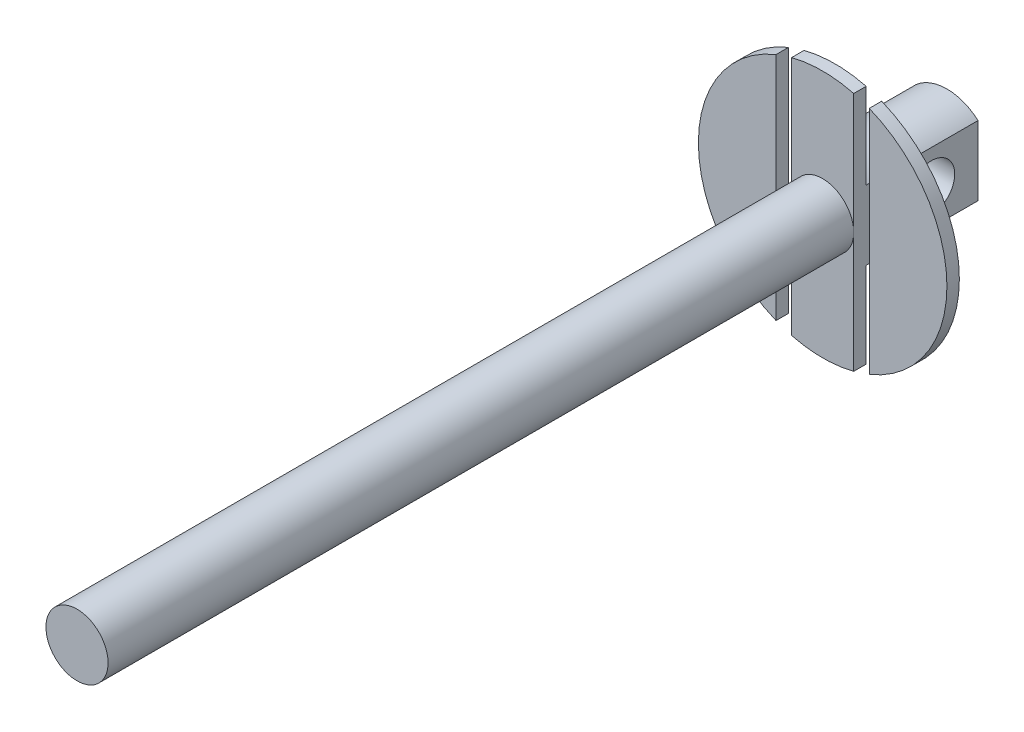
from build123d import *

# Parameters (mm, degrees)
SKETCH1_R               = 25.4
BOSS_EXTRUDE1_DEPTH     = 2.54
SKETCH2_R               = 6.35
BOSS_EXTRUDE2_DEPTH     = 152.4
SKETCH3_R               = 9.525
BOSS_EXTRUDE3_DEPTH     = 22.86
CUT_EXTRUDE2_DEPTH      = 160.049437597
CUT_EXTRUDE2_DEPTH_BACK = 160.049437597
SKETCH4_W               = 3.175
SKETCH4_H               = 25.4
CUT_EXTRUDE3_DEPTH      = 161.18622319
CUT_EXTRUDE3_DEPTH_BACK = 161.18622319
SKETCH5_R               = 4.7625


with BuildPart() as part:
    # Sketch1 → Boss-Extrude1 (new body)
    with BuildSketch(Plane.XY):
        Circle(SKETCH1_R)
    extrude(amount=BOSS_EXTRUDE1_DEPTH)

    # Sketch2 → Boss-Extrude2 (add)
    with BuildSketch(Plane.XY.offset(2.54)):
        Circle(SKETCH2_R)
    extrude(amount=BOSS_EXTRUDE2_DEPTH)

    # Sketch3 → Boss-Extrude3 (add)
    with BuildSketch(Plane(origin=(0, 0, 0), x_dir=(-1, 0, 0), z_dir=(0, 0, -1))):
        Circle(SKETCH3_R)
    extrude(amount=BOSS_EXTRUDE3_DEPTH)

    # Sketch4 → Cut-Extrude2 (cut, two sides: drawn at the far end of the back side and taken through both)
    with BuildSketch(Plane(origin=(0, 0, 0), x_dir=(1, 0, 0), z_dir=(0, 1, 0)).offset(-CUT_EXTRUDE2_DEPTH_BACK)):
        with Locations((7.9375, 10.16)):
            Rectangle(SKETCH4_W, SKETCH4_H)
        with Locations((-7.9375, 10.16)):
            Rectangle(SKETCH4_W, SKETCH4_H)
    extrude(amount=CUT_EXTRUDE2_DEPTH + CUT_EXTRUDE2_DEPTH_BACK, mode=Mode.SUBTRACT)


with BuildPart() as cut_extrude2_piece_1:
    # of the separate pieces the step leaves, piece 1, a body of its own (cut_extrude2_pieces)
    add(part.part.solids().sort_by_distance((6.35, 24.593444248, 0))[0])

    # Sketch5 → Cut-Extrude3 (cut, two sides: drawn at the far end of the back side and taken through both)
    with BuildSketch(Plane.ZY.offset(6.35).offset(-CUT_EXTRUDE3_DEPTH_BACK)):
        with Locations((-13.335, 0)):
            Circle(SKETCH5_R)
    extrude(amount=CUT_EXTRUDE3_DEPTH + CUT_EXTRUDE3_DEPTH_BACK, mode=Mode.SUBTRACT)


with BuildPart() as cut_extrude2_piece_2:
    # of the separate pieces the step leaves, piece 2, a body of its own (cut_extrude2_pieces)
    add(part.part.solids().sort_by_distance((-9.525, 23.546430197, 0))[0])


with BuildPart() as cut_extrude2_piece_3:
    # of the separate pieces the step leaves, piece 3, a body of its own (cut_extrude2_pieces)
    add(part.part.solids().sort_by_distance((9.525, -23.546430197, 0))[0])


solid = Compound([cut_extrude2_piece_1.part, cut_extrude2_piece_2.part, cut_extrude2_piece_3.part])
